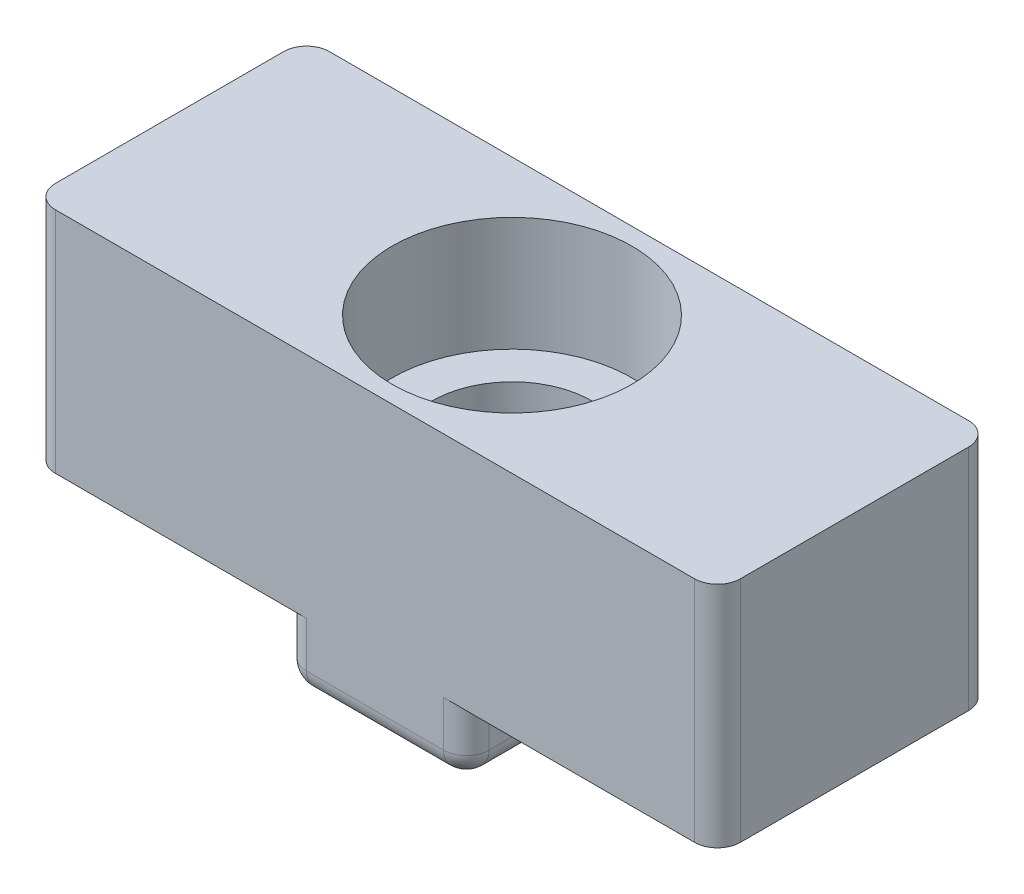
from build123d import *

# Parameters (mm, degrees)
BOSS_EXTRUDE1_DEPTH            = 6
CBORE_FOR_M6_SHCS1_D           = 7
CBORE_FOR_M6_SHCS1_CBORE_D     = 10.5
CBORE_FOR_M6_SHCS1_CBORE_DEPTH = 5
FILLET1_R                      = 1


with BuildPart() as part:
    # Sketch1 → Boss-Extrude1 (new, symmetric)
    with BuildSketch(Plane.XY):
        Polygon((-15, 13), (-15, 3), (-4, 3), (-4, 0), (4, 0), (4, 3), (15, 3), (15, 13), align=None)
    extrude(amount=BOSS_EXTRUDE1_DEPTH, both=True)

    # CBORE for M6 SHCS1 (through all)
    with Locations(Plane(origin=(0, 13, 0), x_dir=(1, 0, 0), z_dir=(0, 1, 0))):
        with Locations((0, 0)):
            CounterBoreHole(CBORE_FOR_M6_SHCS1_D / 2, CBORE_FOR_M6_SHCS1_CBORE_D / 2, CBORE_FOR_M6_SHCS1_CBORE_DEPTH)

    # Fillet1
    # the kernel refuses this fillet: 1 mm, written as the material it takes off along each edge
    with BuildSketch(Plane(origin=(-3, 1, 5), x_dir=(-1, 0, 0), z_dir=(0, 0, 1))) as fillet1_piece_1_section:
        Polygon((0, 0), (FILLET1_R, 0), (FILLET1_R, FILLET1_R), (0, FILLET1_R), align=None)
    fillet1_piece_1 = extrude(amount=FILLET1_R, mode=Mode.PRIVATE)
    fillet1_piece_1 = fillet1_piece_1 - Plane(origin=(-3, 1, 5), x_dir=(0.7071067811865475, 0.7071067811865475, 0), z_dir=(0, 0, 1)) * Sphere(FILLET1_R, mode=Mode.PRIVATE)
    add(fillet1_piece_1, mode=Mode.SUBTRACT)
    with BuildSketch(Plane(origin=(3, 1, -5), x_dir=(0, -1, 0), z_dir=(0, 0, -1))) as fillet1_piece_2_section:
        Polygon((0, 0), (FILLET1_R, 0), (FILLET1_R, -FILLET1_R), (0, -FILLET1_R), align=None)
    fillet1_piece_2 = extrude(amount=FILLET1_R, mode=Mode.PRIVATE)
    fillet1_piece_2 = fillet1_piece_2 - Plane(origin=(3, 1, -5), x_dir=(-0.7071067811865475, 0.7071067811865475, 0), z_dir=(0, 0, -1)) * Sphere(FILLET1_R, mode=Mode.PRIVATE)
    add(fillet1_piece_2, mode=Mode.SUBTRACT)
    with BuildSketch(Plane(origin=(3, 1, 5), x_dir=(0, -1, 0), z_dir=(0, 0, 1))) as fillet1_piece_3_section:
        Polygon((0, 0), (FILLET1_R, 0), (FILLET1_R, FILLET1_R), (0, FILLET1_R), align=None)
    fillet1_piece_3 = extrude(amount=FILLET1_R, mode=Mode.PRIVATE)
    fillet1_piece_3 = fillet1_piece_3 - Plane(origin=(3, 1, 5), x_dir=(-0.7071067811865475, 0.7071067811865475, 0), z_dir=(0, 0, 1)) * Sphere(FILLET1_R, mode=Mode.PRIVATE)
    add(fillet1_piece_3, mode=Mode.SUBTRACT)
    with BuildSketch(Plane(origin=(-3, 1, -5), x_dir=(-1, 0, 0), z_dir=(0, 0, -1))) as fillet1_piece_4_section:
        Polygon((0, 0), (FILLET1_R, 0), (FILLET1_R, -FILLET1_R), (0, -FILLET1_R), align=None)
    fillet1_piece_4 = extrude(amount=FILLET1_R, mode=Mode.PRIVATE)
    fillet1_piece_4 = fillet1_piece_4 - Plane(origin=(-3, 1, -5), x_dir=(0.7071067811865475, 0.7071067811865475, 0), z_dir=(0, 0, -1)) * Sphere(FILLET1_R, mode=Mode.PRIVATE)
    add(fillet1_piece_4, mode=Mode.SUBTRACT)
    with BuildSketch(Plane(origin=(-15, 15.5, -6), x_dir=(0, 0, 1), z_dir=(0, -1, 0)), Plane(origin=(15, 0.5, 6), x_dir=(-1, 0, 0), z_dir=(0, 1, 0))) as fillet1_piece_5:
        with BuildLine():
            CenterArc((FILLET1_R, -FILLET1_R), FILLET1_R, 90, 90)
            Line((0, -FILLET1_R), (0, 0))
            Line((0, 0), (FILLET1_R, 0))
        make_face()
    extrude(amount=15, mode=Mode.SUBTRACT)
    with BuildSketch(Plane(origin=(-4, 3, 6), x_dir=(1, 0, 0), z_dir=(0, -1, 0)), Plane(origin=(4, 1, 6), x_dir=(-1, 0, 0), z_dir=(0, 1, 0))) as fillet1_piece_6:
        with BuildLine():
            CenterArc((FILLET1_R, -FILLET1_R), FILLET1_R, 90, 90)
            Line((0, -FILLET1_R), (0, 0))
            Line((0, 0), (FILLET1_R, 0))
        make_face()
    extrude(amount=2, mode=Mode.SUBTRACT)
    with BuildSketch(Plane(origin=(4, 0, -5), x_dir=(-1, 0, 0), z_dir=(0, 0, 1)), Plane(origin=(-4, 0, -5), x_dir=(0, 1, 0), z_dir=(0, 0, 1))) as fillet1_piece_7:
        with BuildLine():
            CenterArc((FILLET1_R, -FILLET1_R), FILLET1_R, 90, 90)
            Line((0, -FILLET1_R), (0, 0))
            Line((0, 0), (FILLET1_R, 0))
        make_face()
    extrude(amount=10, mode=Mode.SUBTRACT)
    with BuildSketch(Plane(origin=(-3, 0, 6), x_dir=(0, 1, 0), z_dir=(1, 0, 0))) as fillet1_piece_8:
        with BuildLine():
            CenterArc((FILLET1_R, -FILLET1_R), FILLET1_R, 90, 90)
            Line((0, -FILLET1_R), (0, 0))
            Line((0, 0), (FILLET1_R, 0))
        make_face()
    extrude(amount=6, mode=Mode.SUBTRACT)
    with BuildSketch(Plane(origin=(-15, 15.5, 6), x_dir=(0, 0, -1), z_dir=(0, -1, 0)), Plane(origin=(15, 0.5, -6), x_dir=(-1, 0, 0), z_dir=(0, 1, 0))) as fillet1_piece_9:
        with BuildLine():
            CenterArc((FILLET1_R, FILLET1_R), FILLET1_R, 180, 90)
            Line((0, FILLET1_R), (0, 0))
            Line((0, 0), (FILLET1_R, 0))
        make_face()
    extrude(amount=15, mode=Mode.SUBTRACT)
    with BuildSketch(Plane(origin=(4, 1, -6), x_dir=(-1, 0, 0), z_dir=(0, 1, 0)), Plane(origin=(-4, 3, -6), x_dir=(1, 0, 0), z_dir=(0, -1, 0))) as fillet1_piece_10:
        with BuildLine():
            CenterArc((FILLET1_R, FILLET1_R), FILLET1_R, 180, 90)
            Line((0, FILLET1_R), (0, 0))
            Line((0, 0), (FILLET1_R, 0))
        make_face()
    extrude(amount=2, mode=Mode.SUBTRACT)
    with BuildSketch(Plane(origin=(-3, 0, -6), x_dir=(0, 1, 0), z_dir=(1, 0, 0))) as fillet1_piece_11:
        with BuildLine():
            CenterArc((FILLET1_R, FILLET1_R), FILLET1_R, 180, 90)
            Line((0, FILLET1_R), (0, 0))
            Line((0, 0), (FILLET1_R, 0))
        make_face()
    extrude(amount=6, mode=Mode.SUBTRACT)


solid = part.part
